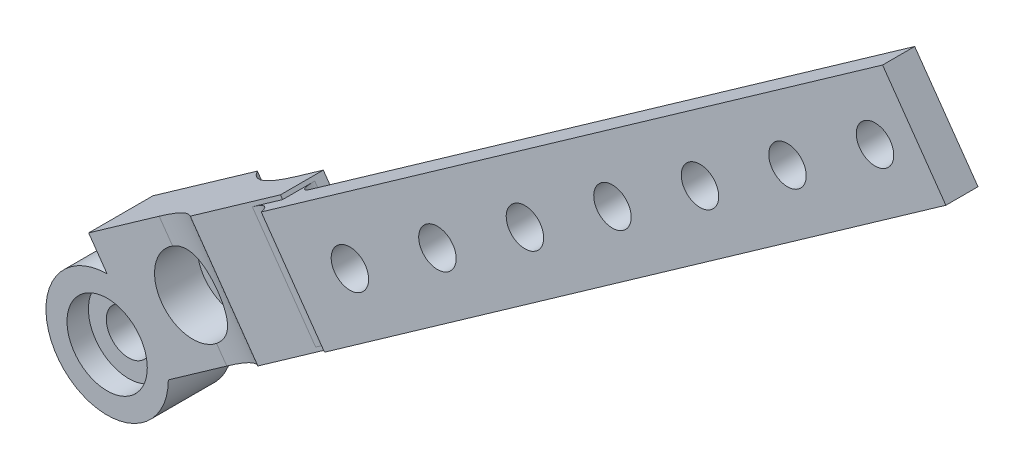
from build123d import *

# Parameters (mm, degrees)
SKETCH_1_R                     = 2.1
EXTRUDE_1_DEPTH                = 2
EXTRUDE_2_DEPTH                = 40
EXTRUDE_3_DEPTH                = 2
EXTRUDE_START                  = -4
SKETCH_10_R                    = 2.075
EXTRUDE_4_DEPTH                = 4
SKETCH_14_R                    = 3.5715559825460215
CUT_EXTRUDE_6_DEPTH            = 4
EXTRUDE_5_DEPTH                = 2
EXTRUDE_START_2                = 2
SKETCH_19_R                    = 2.075
EXTRUDE_6_DEPTH                = 2
CUT_EXTRUDE_START              = -2
SKETCH_22_R                    = 3.5715559825460206
CUT_EXTRUDE_11_DEPTH           = 2
SKETCH_23_R                    = 3.75
CUT_EXTRUDE_12_DEPTH           = 2
FILLET_5_R                     = 13
FILLET_6_R                     = 10
CUT_EXTRUDE_13_DEPTH           = 28.999999999999996
CUT_EXTRUDE_14_DEPTH           = 12.999999999999984
SKETCH_29_R                    = 3.0000000000000084
SKETCH_29_R_2                  = 3.0000000000000018
SKETCH_29_R_3                  = 1.2000000000000004
EXTRUDE_8_DEPTH                = 13
CUT_EXTRUDE_15_DEPTH           = 13
M3X0_5_1_D                     = 2.8
FILLET_8_R                     = 5
EXTRUDE_9_DEPTH                = 1.9999999999999991
EXTRUDE_10_DEPTH               = 4.5
EXTRUDE_11_DEPTH               = 0.5
FILLET_9_R                     = 0.5
CUT_EXTRUDE_16_DEPTH           = 9.500000000000002
EXTRUDE_12_DEPTH               = 2
CUT_EXTRUDE_17_DEPTH           = 50.00000000000002
SKETCH_42_W                    = 39.21300819263915
SKETCH_42_H                    = 42.57339221101679
CUT_EXTRUDE_19_DEPTH           = 50.00000000000002
SKETCH_44_W                    = 3.999999999999999
SKETCH_44_H                    = 10.963872604458988
EXTRUDE_13_DEPTH               = 60.00000000000003
SKETCH_45_W                    = 1.9999999999999996
SKETCH_45_H                    = 10.963872604458988
CUT_EXTRUDE_20_DEPTH           = 73.00000000000004
SKETCH_46_R                    = 1.7500000000000004
SKETCH_46_R_2                  = 1.7500000000000038
SKETCH_46_R_3                  = 1.749999999999997
SKETCH_46_R_4                  = 1.7500000000000104
CUT_EXTRUDE_21_DEPTH           = 70.00000000000003
SKETCH_47_W                    = 1.9999999999999996
SKETCH_47_H                    = 10.963872604458988
CUT_EXTRUDE_22_DEPTH           = 1.9999999999999967
CUT_EXTRUDE_23_DEPTH           = 10
EXTRUDE_16_DEPTH               = 73.00000000000003
SKETCH_52_R                    = 1.7500000000000104
SKETCH_52_R_2                  = 1.749999999999997
SKETCH_52_R_3                  = 1.7500000000000038
SKETCH_52_R_4                  = 1.7500000000000004
CUT_EXTRUDE_24_DEPTH           = 73.00000000000003
SPLIT_BODIES_1_SURFACE_1_BACK  = 112.869
SPLIT_BODIES_1_SURFACE_1_DEPTH = 225.738
SPLIT_BODIES_1_SURFACE_2_BACK  = 112.869
SPLIT_BODIES_1_SURFACE_2_DEPTH = 225.738
FILLET_11_R                    = 2
FILLET_12_R                    = 4


# Read off the part's stored shape, not the designer's step: 实体-删除/保留 1
with BuildPart() as part:
    # 草图1 → 凸台-拉伸1 (new body)
    with BuildSketch(Plane.XY):
        with BuildLine():
            Line((5.715095935783956, 0), (15.341111112939824, 6.784600591097247))
            Line((15.341111112939824, 6.784600591097247), (42.49706355926069, 25.92463804463833))
            Line((42.49706355926069, 25.92463804463833), (52.86691877711603, 11.211850995247643))
            Line((52.86691877711603, 11.211850995247643), (93.73577169209018, 40.017004378179195))
            Line((93.73577169209018, 40.017004378179195), (42.483411773869754, 112.7340328625418))
            Line((42.483411773869754, 112.7340328625418), (1.6145588588956372, 83.92887947961026))
            Line((1.6145588588956372, 83.92887947961026), (36.18074291841349, 34.88625598164134))
            Line((36.18074291841349, 34.88625598164134), (-1.7283092029758853, 8.167227110682408))
            Line((-1.7283092029758853, 8.167227110682408), (0, 5.715095935783956))
            ThreePointArc((0, 5.715095935783956), (-4.0411830913245135, -4.041183091324513), (5.715095935783956, 0))
        make_face()
        Circle(SKETCH_1_R, mode=Mode.SUBTRACT)
        with BuildLine():
            Line((7.071067811864017, 9.899494936610912), (6.585786437625429, 9.414213562372302))
            ThreePointArc((6.585786437625429, 9.414213562372302), (6.585786437625458, 6.585786437626118), (9.41421356237164, 6.58578643762615))
            Line((9.41421356237164, 6.58578643762615), (9.899494936610207, 7.071067811864724))
            ThreePointArc((9.899494936610207, 7.071067811864724), (9.899494936610207, 9.899494936610912), (7.071067811864017, 9.899494936610912))
        make_face(mode=Mode.SUBTRACT)
    extrude(amount=EXTRUDE_1_DEPTH)

    # 草图2 → 凸台-拉伸2 (add)
    with BuildSketch(Plane.XY.offset(2)):
        Polygon((2.4787134603835828, 82.70281389216105), (42.12150078790845, 110.64381267360466), (91.64555150315304, 40.37891536414052), (52.00276417562808, 12.43791658269687), (52.86691877711603, 11.211850995247648), (93.73577169209018, 40.017004378179195), (42.483411773869754, 112.7340328625418), (1.6145588588956372, 83.92887947961026), align=None)
    extrude(amount=EXTRUDE_2_DEPTH)

    # 草图4 → 凸台-拉伸3 (add)
    with BuildSketch(Plane.XY.offset(42)):
        Polygon((93.73577169209018, 40.017004378179195), (52.86691877711603, 11.211850995247648), (1.6145588588956372, 83.92887947961026), (42.483411773869754, 112.7340328625418), align=None)
    extrude(amount=EXTRUDE_3_DEPTH)

    # 草图10 → 凸台-拉伸4 (add)
    with BuildSketch(Plane.XY.offset(2).offset(EXTRUDE_START)):
        with BuildLine():
            Line((8.031882820422537, 15.046398123036559), (14.348203461269724, 6.084780186033628))
            Line((14.348203461269724, 6.084780186033628), (5.715095935783956, 0))
            ThreePointArc((5.715095935783956, 0), (-4.0411830913245135, -4.041183091324513), (0, 5.715095935783956))
            Line((0, 5.715095935783956), (-1.7283092029758853, 8.167227110682408))
            Line((-1.7283092029758853, 8.167227110682408), (8.031882820422537, 15.046398123036559))
        make_face()
        Circle(SKETCH_10_R, mode=Mode.SUBTRACT)
        with BuildLine():
            Line((7.071067811864017, 9.899494936610912), (6.58578643762543, 9.4142135623723))
            ThreePointArc((6.58578643762543, 9.4142135623723), (6.585786437625461, 6.585786437626118), (9.414213562371643, 6.58578643762615))
            Line((9.414213562371643, 6.58578643762615), (9.899494936610205, 7.071067811864723))
            ThreePointArc((9.899494936610205, 7.071067811864723), (9.899494936610207, 9.899494936610912), (7.071067811864017, 9.899494936610912))
        make_face(mode=Mode.SUBTRACT)
    extrude(amount=EXTRUDE_4_DEPTH)

    # 草图14 → 切除-拉伸6 (cut)
    with BuildSketch(Plane(origin=(0, 0, 0), x_dir=(-1, 0, 0), z_dir=(0, 0, -1))):
        with Locations((-7.999999999998536, 7.999999999999225)):
            Circle(SKETCH_14_R)
    extrude(amount=-CUT_EXTRUDE_6_DEPTH, mode=Mode.SUBTRACT)

    # 草图17 → 凸台-拉伸5 (add)
    with BuildSketch(Plane.XY.offset(2)):
        Polygon((9.763733946874806, 16.267040097932394), (16.080054587722028, 7.305422160929461), (83.36591647423481, 54.72979142756991), (77.0495958333876, 63.691409364572834), align=None)
    extrude(amount=EXTRUDE_5_DEPTH)

    # 草图19 → 凸台-拉伸6 (add)
    with BuildSketch(Plane(origin=(0, 0, -2), x_dir=(-1, 0, 0), z_dir=(0, 0, -1)).offset(EXTRUDE_START_2)):
        with BuildLine():
            Line((1.7283092029758853, 8.167227110682408), (-8.031882820422537, 15.046398123036559))
            Line((-8.031882820422537, 15.046398123036559), (-14.348203461269724, 6.084780186033628))
            Line((-14.348203461269724, 6.084780186033628), (-5.715095935783956, 0))
            ThreePointArc((-5.715095935783956, 0), (4.041183091324512, -4.0411830913245135), (3.5e-16, 5.715095935783956))
            Line((3.5e-16, 5.715095935783956), (1.7283092029758853, 8.167227110682408))
        make_face()
        with Locations(Location((0, 0, 0), (0, 0, 180))):
            Circle(SKETCH_19_R, mode=Mode.SUBTRACT)
        with BuildLine():
            Line((-9.414213562371643, 6.58578643762615), (-9.899494936610205, 7.071067811864723))
            ThreePointArc((-9.899494936610205, 7.071067811864723), (-9.899494936610207, 9.899494936610914), (-7.071067811864017, 9.899494936610912))
            Line((-7.071067811864017, 9.899494936610912), (-6.58578643762543, 9.4142135623723))
            ThreePointArc((-6.58578643762543, 9.4142135623723), (-6.585786437625462, 6.585786437626118), (-9.414213562371643, 6.58578643762615))
        make_face(mode=Mode.SUBTRACT)
    extrude(amount=-EXTRUDE_6_DEPTH)

    # 草图22 → 切除-拉伸11 (cut)
    with BuildSketch(Plane.XY.offset(CUT_EXTRUDE_START)):
        with Locations((7.999999999998536, 7.999999999999225)):
            Circle(SKETCH_22_R)
    extrude(amount=CUT_EXTRUDE_11_DEPTH, mode=Mode.SUBTRACT)

    # 草图23 → 切除-拉伸12 (cut)
    with BuildSketch(Plane.XY.offset(2)):
        Circle(SKETCH_23_R)
    extrude(amount=-CUT_EXTRUDE_12_DEPTH, mode=Mode.SUBTRACT)

    # 圆角5
    # the kernel refuses this fillet: 13 mm, written as the material it adds along each edge
    with BuildSketch(Plane(origin=(14.348203461269723, 6.084780186033624, 2.2e-16), x_dir=(8e-16, 5.7e-16, -1), z_dir=(-0.5761030676586291, 0.8173770582994835, 0))) as fillet_5_piece_1:
        with BuildLine():
            CenterArc((13.000000000000009, -9.38083151964685), FILLET_5_R, 133.81306146040322, 46.18693853959684)
            Line((9.43e-15, -9.380831519646863), (-0.25999999999999057, -9.380831519646863))
            Line((-0.25999999999999057, -9.380831519646863), (-0.26, 3.4e-16))
            Line((-0.26, 3.4e-16), (-2.6e-16, 0.26000000000000023))
            ThreePointArc((-2.6e-16, 0.26000000000000023), (1.9999999999999998, 0.2599999999999987), (3.8200000000000003, 0.1876166303929368))
            Line((3.8200000000000003, 0.1876166303929368), (4, 0))
        make_face()
    extrude(amount=10.963872604458924)

    # 圆角6
    # the kernel refuses this fillet: 10 mm, written as the material it adds along each edge
    with BuildSketch(Plane(origin=(9.763733946874806, 16.267040097932394, 2), x_dir=(-0.8173770582994822, -0.5761030676586308, 0), z_dir=(0.576103067658631, -0.8173770582994822, 0))) as fillet_6_piece_1_section:
        with BuildLine():
            CenterArc((6.000000000000636, -10.000000000000002), FILLET_6_R, 90, 36.86989764584695)
            Line((2.2818e-13, -2.000000000000304), (-0.11999999999977938, -1.8400000000003103))
            ThreePointArc((-0.11999999999977938, -1.8400000000003103), (-0.20000000000000048, -1.000000000000152), (-0.20000000000000048, 0))
            Line((-0.20000000000000048, 0), (-1.45e-15, 0.2))
            Line((-1.45e-15, 0.2), (6.000000000000636, 0.2))
            Line((6.000000000000636, 0.2), (6.000000000000636, 0))
        make_face()
    fillet_6_piece_1 = extrude(amount=10.963872604458947, mode=Mode.PRIVATE)
    fillet_6_piece_1 = fillet_6_piece_1 - Plane(origin=(7.999999999998536, 7.999999999999225, 2), x_dir=(-1, 0, 0), z_dir=(0, 0, -1)) * Cylinder(3.5715559825460215, 46, mode=Mode.PRIVATE)
    add(fillet_6_piece_1)

    # 草图24 → 切除-拉伸13 (cut)
    with BuildSketch(Plane.XY.offset(44.00000000000001)):
        Polygon((1.6145588588956372, 83.92887947961026), (42.483411773869754, 112.7340328625418), (93.73577169209018, 40.017004378179195), (52.86691877711603, 11.211850995247648), (2.4787134603835828, 82.70281389216105), align=None)
    extrude(amount=-CUT_EXTRUDE_13_DEPTH, mode=Mode.SUBTRACT)

    # 草图25 → 切除-拉伸14 (cut)
    with BuildSketch(Plane.XY.offset(15.000000000000007)):
        Polygon((2.4787134603835828, 82.70281389216105), (1.6145588588956372, 83.92887947961026), (42.48341177386975, 112.7340328625418), (93.73577169209018, 40.017004378179195), (52.86691877711603, 11.211850995247648), (52.00276417562802, 12.437916582696838), (91.64555150315304, 40.37891536414052), (42.12150078790842, 110.64381267360463), align=None)
    extrude(amount=-CUT_EXTRUDE_14_DEPTH, mode=Mode.SUBTRACT)

    # 草图29 → 凸台-拉伸8 (add)
    with BuildSketch(Plane.XY.offset(2)):
        with Locations(Location((86.76837106229962, 41.223374331383454, 0), (0, 0, 180))):
            Circle(SKETCH_29_R)
        with Locations(Location((51.2228117877621, 91.65553882846152, 0), (0, 0, 180))):
            Circle(SKETCH_29_R_2)
        with Locations(Location((35.247091362615166, 45.46860572527032, 0), (0, 0, 180))):
            Circle(SKETCH_29_R_3)
    extrude(amount=EXTRUDE_8_DEPTH)

    # 草图30 → 切除-拉伸15 (cut)
    with BuildSketch(Plane.XY.offset(2)):
        Polygon((1.6145588588956372, 83.92887947961026), (42.48341177386975, 112.7340328625418), (53.29333634245431, 97.39687387080285), (12.424483427480185, 68.59172048787134), align=None)
    extrude(amount=-CUT_EXTRUDE_15_DEPTH, mode=Mode.SUBTRACT)

    # M3x0.5 螺纹孔1 (through all)
    with Locations(Plane.XY.offset(15)):
        with Locations((51.222811788, 91.655538828), (86.768371062, 41.223374331)):
            Hole(M3X0_5_1_D / 2)

    # 圆角8
    # the kernel refuses this fillet: 5 mm, written as the material it takes off along each edge
    with BuildSketch(Plane(origin=(52.86691877711603, 11.21185099524764, -12.500000000000018), x_dir=(-0.57610306765863, 0.8173770582994827, 0), z_dir=(0, 1.2e-16, 1))) as fillet_8_piece_1:
        with BuildLine():
            CenterArc((FILLET_8_R, -FILLET_8_R), FILLET_8_R, 90.00000000000001, 90.00000000000011)
            Line((4.76e-15, -FILLET_8_R), (0, 0))
            Line((0, 0), (FILLET_8_R, 1e-17))
        make_face()
    extrude(amount=27.000000000000057, mode=Mode.SUBTRACT)
    with BuildSketch(Plane(origin=(93.73577169209018, 40.017004378179195, -12.499999999999993), x_dir=(-0.8173770582994824, -0.5761030676586305, 0), z_dir=(0, 0, 1))) as fillet_8_piece_2:
        with BuildLine():
            CenterArc((FILLET_8_R, -FILLET_8_R), FILLET_8_R, 90, 90)
            Line((-5.2e-16, -FILLET_8_R), (0, 0))
            Line((0, 0), (FILLET_8_R, -2.3e-16))
        make_face()
    extrude(amount=27.000000000000007, mode=Mode.SUBTRACT)
    with BuildSketch(Plane(origin=(12.424483427480185, 68.59172048787134, 14.499999999999991), x_dir=(0.5761030676586302, -0.8173770582994826, 0), z_dir=(0, 0, -1))) as fillet_8_piece_3:
        with BuildLine():
            CenterArc((FILLET_8_R, -FILLET_8_R), FILLET_8_R, 90, 89.99999999999989)
            Line((-6.63e-15, -FILLET_8_R), (0, 0))
            Line((0, 0), (FILLET_8_R, -4e-16))
        make_face()
    extrude(amount=26.999999999999982, mode=Mode.SUBTRACT)
    with BuildSketch(Plane(origin=(53.29333634245431, 97.39687387080285, 14.499999999999993), x_dir=(-0.8173770582994824, -0.5761030676586305, 0), z_dir=(0, 0, -1))) as fillet_8_piece_4:
        with BuildLine():
            CenterArc((FILLET_8_R, -FILLET_8_R), FILLET_8_R, 90, 90)
            Line((5.2e-16, -FILLET_8_R), (0, 0))
            Line((0, 0), (FILLET_8_R, 2.3e-16))
        make_face()
    extrude(amount=26.999999999999986, mode=Mode.SUBTRACT)

    # 草图35 → 凸台-拉伸9 (add)
    with BuildSketch(Plane.XY.offset(2)):
        Polygon((83.9272469924964, 33.10376756627563), (63.492820535009336, 18.701190874809864), (72.1343665498888, 6.440535000317625), (92.56879300737585, 20.843111691783392), align=None)
    extrude(amount=-EXTRUDE_9_DEPTH)

    # 草图36 → 凸台-拉伸10 (add)
    with BuildSketch(Plane.XY.offset(2)):
        Polygon((83.9272469924964, 33.10376756627563), (88.65129214729717, 26.401275688219865), (87.69528224340063, 25.727461525276922), (84.0082226103854, 30.95867469839361), (64.52980605679488, 17.2299121698708), (63.49282053500935, 18.70119087480987), align=None)
        Polygon((72.1343665498888, 6.440535000317625), (92.56879300737585, 20.843111691783392), (91.5318074855903, 22.31439039672246), (71.09738102810324, 7.911813705256714), align=None)
    extrude(amount=EXTRUDE_10_DEPTH)

    # 草图38 → 凸台-拉伸11 (add)
    with BuildSketch(Plane.XY.offset(6.5)):
        Polygon((71.20701372358899, 21.936136526395817), (79.77043226489411, 27.97179857636138), (80.48699168922953, 26.955141545284572), (71.92357314792442, 20.919479495319017), align=None)
        Polygon((86.2422183193346, 18.586186241257604), (77.41533643660377, 12.36483016223927), (76.64618005583336, 13.456111940066782), (85.47306193856419, 19.677468019085115), align=None)
    extrude(amount=-EXTRUDE_11_DEPTH)

    # 圆角9
    fillet_9_edges = [part.edges().sort_by_distance(p)[0] for p in [
        (75.48872299424156, 24.953967551378597, 6),
        (81.82877737796917, 15.475508201748436, 6),
    ]]
    fillet(fillet_9_edges, radius=FILLET_9_R)

    # 草图40 → 切除-拉伸16 (cut)
    with BuildSketch(Plane.XY.offset(2)):
        Polygon((65.96583570106971, 15.192468260678279), (69.64530996532923, 9.972017235426623), (86.89967078383748, 22.133222516514135), (83.22019651957794, 27.353673541765804), align=None)
        Polygon((79.13062239501116, 33.15597569096527), (85.72890544742685, 37.806572461671124), (80.1765478028438, 45.68427701304691), (50.06316674834756, 24.459787009423422), (55.61552439293061, 16.582082458047644), align=None)
        Polygon((39.25145299063004, 45.68427701304691), (67.37307339397086, 65.5049358110826), (63.37371277016225, 71.17924272816451), (35.25209236682142, 51.35858393012882), align=None)
        Polygon((30.685761748669528, 51.952517364922464), (63.37371277016222, 74.99161378651206), (59.82181706782164, 80.03105589947442), (27.133866046328958, 56.99195947788482), align=None)
        Polygon((26.06105069463626, 58.51407367149419), (23.152992111790248, 62.64003741522087), (55.84094313328293, 85.6791338368105), (58.74900171612895, 81.55317009308379), align=None)
        Polygon((21.894829409934886, 64.42512308102752), (19.378576670767988, 67.99519131593051), (49.49195772526422, 89.2196813195541), (51.98740367066816, 85.6791338368105), align=None)
    extrude(amount=-CUT_EXTRUDE_16_DEPTH, mode=Mode.SUBTRACT)

    # 草图41 → 凸台-拉伸12 (add)
    with BuildSketch(Plane.XY.offset(2)):
        Polygon((69.64530996532923, 9.972017235426623), (65.96583570106971, 15.192468260678279), (66.98240526122602, 15.908966033827006), (70.66187952548556, 10.688515008575354), align=None)
    extrude(amount=-EXTRUDE_12_DEPTH)

    # 草图3 → 切除-拉伸17 (cut)
    with BuildSketch(Plane.XY.offset(42)):
        Polygon((1.6145588588956372, 83.92887947961026), (52.86691877711603, 11.211850995247648), (93.73577169209018, 40.017004378179195), (42.48341177386975, 112.7340328625418), align=None)
    extrude(amount=-CUT_EXTRUDE_17_DEPTH, mode=Mode.SUBTRACT)


with BuildPart() as cut_extrude_17_piece_1:
    # of the separate pieces the step leaves, piece 1, a body of its own (cut_extrude_17_pieces)
    add(part.part.solids().sort_by_distance((22.015879933, 11.489106002, 0))[0])


with BuildPart() as cut_extrude_17_piece_2:
    # of the separate pieces the step leaves, piece 2, a body of its own (cut_extrude_17_pieces)
    add(part.part.solids().sort_by_distance((71.207013724, 21.936136526, 5.5))[0])


with BuildPart() as cut_extrude_19_tool:
    # 草图42 → 切除-拉伸19 (new body)
    with BuildSketch(Plane.XY.offset(6.5)):
        Polygon((28.815346269643545, 29.694982797748935), (35.13166691049081, 20.73336486074598), (48.41112186379118, 17.53375132498441), (30.419712241827142, 43.06002656463614), align=None)
        with Locations((76.58542458379063, 21.286696105508394)):
            Rectangle(SKETCH_42_W, SKETCH_42_H)
    extrude(amount=-CUT_EXTRUDE_19_DEPTH)


with BuildPart() as cut_extrude_17_piece_1_1:
    add(cut_extrude_17_piece_1.part)

    # 切除-拉伸19: cut by cut_extrude_19_tool
    add(cut_extrude_19_tool.part, mode=Mode.SUBTRACT)

    # 草图44 → 凸台-拉伸13 (add)
    with BuildSketch(Plane(origin=(33.234856604715326, 23.424565992842005, 0), x_dir=(0, 0, -1), z_dir=(0.817377058299481, 0.5761030676586324, 0))):
        with Locations((-1.9999999999999996, 2.18945200166085)):
            Rectangle(SKETCH_44_W, SKETCH_44_H)
    extrude(amount=EXTRUDE_13_DEPTH)

    # 草图45 → 切除-拉伸20 (cut)
    with BuildSketch(Plane(origin=(82.27748010268421, 57.990750052359964, 0), x_dir=(0, 0, -1), z_dir=(0.817377058299481, 0.5761030676586324, 0))):
        with Locations((-2.999999999999999, 2.18945200166085)):
            Rectangle(SKETCH_45_W, SKETCH_45_H)
    extrude(amount=-CUT_EXTRUDE_20_DEPTH, mode=Mode.SUBTRACT)

    # 草图46 → 切除-拉伸21 (cut)
    with BuildSketch(Plane.XY.offset(1.9999999999999996)):
        with Locations((26.674994885127283, 21.482049818624887)):
            Circle(SKETCH_46_R)
        with Locations((34.848933258484564, 27.242842426292455)):
            Circle(SKETCH_46_R_2)
        with Locations((43.022871631841845, 33.003635033960016)):
            Circle(SKETCH_46_R_2)
        with Locations((51.19681000519913, 38.76442764162759)):
            Circle(SKETCH_46_R_3)
        with Locations((59.370748378556414, 44.52522024929516)):
            Circle(SKETCH_46_R_3)
        with Locations((67.5446867519137, 50.28601285696273)):
            Circle(SKETCH_46_R_4)
        with Locations((75.71862512527099, 56.04680546463029)):
            Circle(SKETCH_46_R_4)
    extrude(amount=-CUT_EXTRUDE_21_DEPTH, mode=Mode.SUBTRACT)

    # 草图47 → 切除-拉伸22 (cut)
    with BuildSketch(Plane(origin=(82.27748010268421, 57.990750052359964, 0), x_dir=(0, 0, -1), z_dir=(0.817377058299481, 0.5761030676586324, 0))):
        with Locations((-0.9999999999999998, 2.18945200166085)):
            Rectangle(SKETCH_47_W, SKETCH_47_H)
    extrude(amount=-CUT_EXTRUDE_22_DEPTH, mode=Mode.SUBTRACT)

    # 草图48 → 切除-拉伸23 (cut)
    with BuildSketch(Plane.XY.offset(1.9999999999999996)):
        Polygon((24.50576515259755, 13.244024981183752), (82.53953629186074, 54.14734278494668), (82.33790021818015, 54.433424755351595), (24.304129078917033, 13.530106951588571), align=None)
        Polygon((18.39108058543081, 21.9195609477819), (18.18944451175029, 22.20564291818672), (76.22321565101348, 63.10896072194963), (76.42485172469398, 62.82287875154481), align=None)
    extrude(amount=-CUT_EXTRUDE_23_DEPTH, mode=Mode.SUBTRACT)

    # 草图51 → 凸台-拉伸16 (add)
    with BuildSketch(Plane(origin=(80.64272598608528, 56.838543917042685, 0), x_dir=(0, 0, -1), z_dir=(0.8173770582994812, 0.5761030676586322, 0))):
        Polygon((-1.9999999999999996, 7.321388303890359), (-2.9999999999999996, 7.321388303890359), (-2.9999999999999982, -2.942484300568633), (-1.9999999999999982, -2.942484300568633), align=None)
    extrude(amount=-EXTRUDE_16_DEPTH)

    # 草图52 → 切除-拉伸24 (cut)
    with BuildSketch(Plane(origin=(0, 0, 0), x_dir=(-1, 0, 0), z_dir=(0, 0, -1))):
        with Locations(Location((-67.5446867519137, 50.28601285696273, 0), (0, 0, 180))):
            Circle(SKETCH_52_R)
        with Locations(Location((-75.71862512527099, 56.04680546463029, 0), (0, 0, 180))):
            Circle(SKETCH_52_R)
        with Locations(Location((-59.370748378556414, 44.52522024929516, 0), (0, 0, 180))):
            Circle(SKETCH_52_R_2)
        with Locations(Location((-51.19681000519913, 38.76442764162759, 0), (0, 0, 180))):
            Circle(SKETCH_52_R_2)
        with Locations(Location((-43.022871631841845, 33.003635033960016, 0), (0, 0, 180))):
            Circle(SKETCH_52_R_3)
        with Locations(Location((-34.848933258484564, 27.242842426292455, 0), (0, 0, 180))):
            Circle(SKETCH_52_R_3)
        with Locations(Location((-26.674994885127283, 21.482049818624887, 0), (0, 0, 180))):
            Circle(SKETCH_52_R_4)
    extrude(amount=-CUT_EXTRUDE_24_DEPTH, mode=Mode.SUBTRACT)


with BuildPart() as cut_extrude_17_piece_2_1:
    add(cut_extrude_17_piece_2.part)

    # 切除-拉伸19: cut by cut_extrude_19_tool
    add(cut_extrude_19_tool.part, mode=Mode.SUBTRACT)


with BuildPart() as body_2:
    # Split Bodies 1: the piece behind the surface
    add(cut_extrude_17_piece_1_1.part)
    # Split Bodies 1 surface: a surface, the sketch's curves swept straight by 225.738 mm
    with BuildLine(Plane.XY.offset(2.9999999999999987).offset(-SPLIT_BODIES_1_SURFACE_1_BACK), mode=Mode.PRIVATE) as split_bodies_1_surface_1_path:
        Line((18.18944451175029, 22.20564291818672), (24.50576515259755, 13.244024981183752))
    split_bodies_1_surface_1 = Shell.extrude(split_bodies_1_surface_1_path.wire(), (0 * SPLIT_BODIES_1_SURFACE_1_DEPTH, 0 * SPLIT_BODIES_1_SURFACE_1_DEPTH, 1 * SPLIT_BODIES_1_SURFACE_1_DEPTH))
    split(bisect_by=split_bodies_1_surface_1, keep=Keep.BOTTOM)


with BuildPart() as cut_extrude_17_piece_1_2:
    add(cut_extrude_17_piece_1_1.part)

    # Split Bodies 1: split by a surface, the side it looks to stays
    # Split Bodies 1 surface: a surface, the sketch's curves swept straight by 225.738 mm
    with BuildLine(Plane.XY.offset(2.9999999999999987).offset(-SPLIT_BODIES_1_SURFACE_2_BACK), mode=Mode.PRIVATE) as split_bodies_1_surface_2_path:
        Line((18.18944451175029, 22.20564291818672), (24.50576515259755, 13.244024981183752))
    split_bodies_1_surface_2 = Shell.extrude(split_bodies_1_surface_2_path.wire(), (0 * SPLIT_BODIES_1_SURFACE_2_DEPTH, 0 * SPLIT_BODIES_1_SURFACE_2_DEPTH, 1 * SPLIT_BODIES_1_SURFACE_2_DEPTH))
    split(bisect_by=split_bodies_1_surface_2, keep=Keep.TOP)


with BuildPart() as body_3:
    # Move Body 3: copy of 切除-拉伸17 piece 1
    add(cut_extrude_17_piece_1_2.part.moved(Location((0, 0, 3))))

    # Combine 1: union body 2
    add(body_2.part)

    # 圆角11
    fillet_11_edges = [body_3.edges().sort_by_distance(p)[0] for p in [
        (21.347604832173918, 17.724833949685234, 3.0000000000000147),
    ]]
    fillet(fillet_11_edges, radius=FILLET_11_R)

    # 圆角12
    # the kernel refuses this fillet: 4 mm, written as the material it adds along each edge
    with BuildSketch(Plane(origin=(24.304129078917025, 13.530106951588564, 3.999999999999999), x_dir=(-5.198e-14, -3.664e-14, 1), z_dir=(-0.5761030676586324, 0.817377058299481, 0))) as fillet_12_piece_1:
        with BuildLine():
            CenterArc((4.000000000000221, -3.4641016151376753), FILLET_12_R, 120.00000000000229, 60.000000000001364)
            Line((2.212e-13, -3.46410161513793), (0, 0))
            Line((0, 0), (2.0000000000000826, 0))
        make_face()
    extrude(amount=10.263872604458996)


solid = body_3.part
